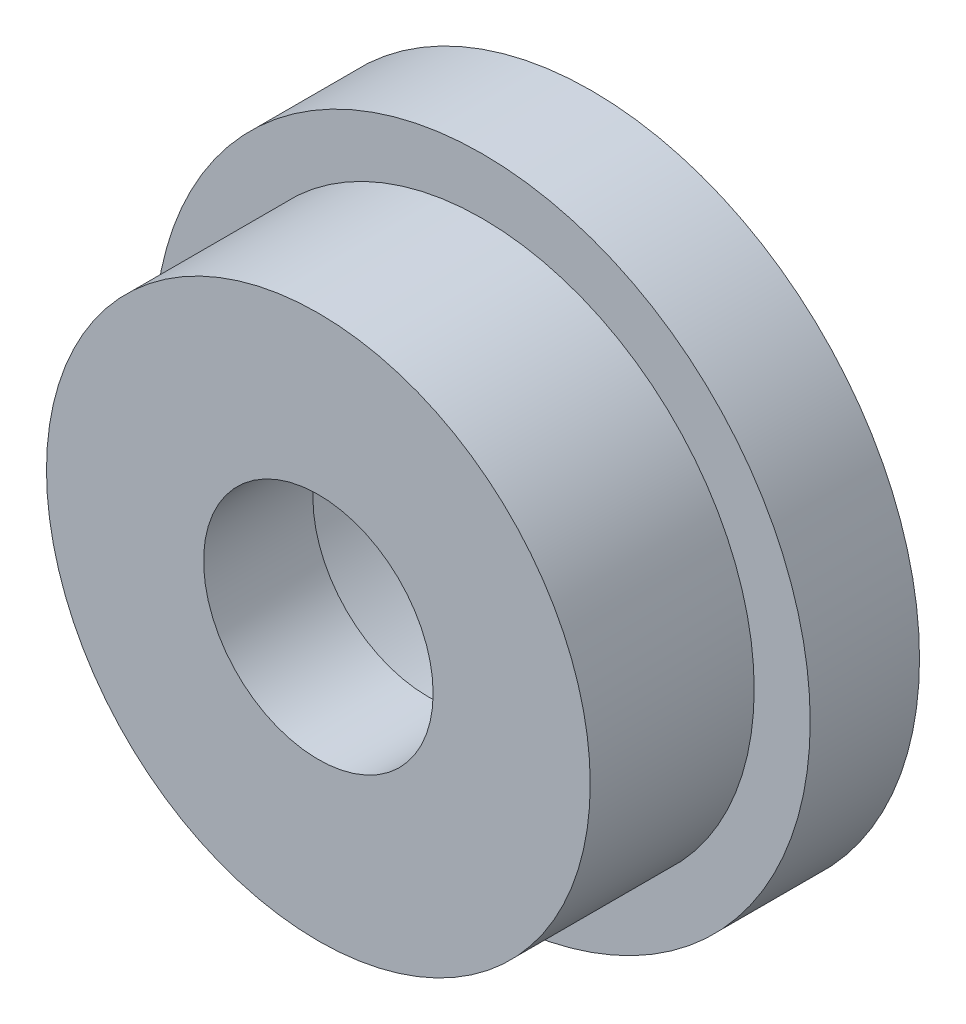
from build123d import *

# Parameters (mm, degrees)
SKETCH_1_R          = 4.975
EXTRUDE_1_DEPTH     = 3
SKETCH_2_R          = 6
EXTRUDE_2_DEPTH     = 2
SKETCH_3_R          = 2.1
CUT_EXTRUDE_1_DEPTH = 10.848857802
SKETCH_4_R          = 4
CUT_EXTRUDE_2_DEPTH = 3


with BuildPart() as part:
    # ｽｹｯﾁ1 → ﾎﾞｽ - 押し出し1 (new body)
    with BuildSketch(Plane.XY):
        Circle(SKETCH_1_R)
    extrude(amount=EXTRUDE_1_DEPTH)

    # ｽｹｯﾁ2 → ﾎﾞｽ - 押し出し2 (add)
    with BuildSketch(Plane(origin=(0, 0, 0), x_dir=(-1, 0, 0), z_dir=(0, 0, -1))):
        Circle(SKETCH_2_R)
    extrude(amount=EXTRUDE_2_DEPTH)

    # ｽｹｯﾁ3 → ｶｯﾄ - 押し出し1 (cut, through all)
    with BuildSketch(Plane.XY.offset(3)):
        Circle(SKETCH_3_R)
    extrude(amount=-CUT_EXTRUDE_1_DEPTH, mode=Mode.SUBTRACT)

    # ｽｹｯﾁ4 → ｶｯﾄ - 押し出し2 (cut)
    with BuildSketch(Plane(origin=(0, 0, -2), x_dir=(-1, 0, 0), z_dir=(0, 0, -1))):
        Circle(SKETCH_4_R)
    extrude(amount=-CUT_EXTRUDE_2_DEPTH, mode=Mode.SUBTRACT)


solid = part.part
